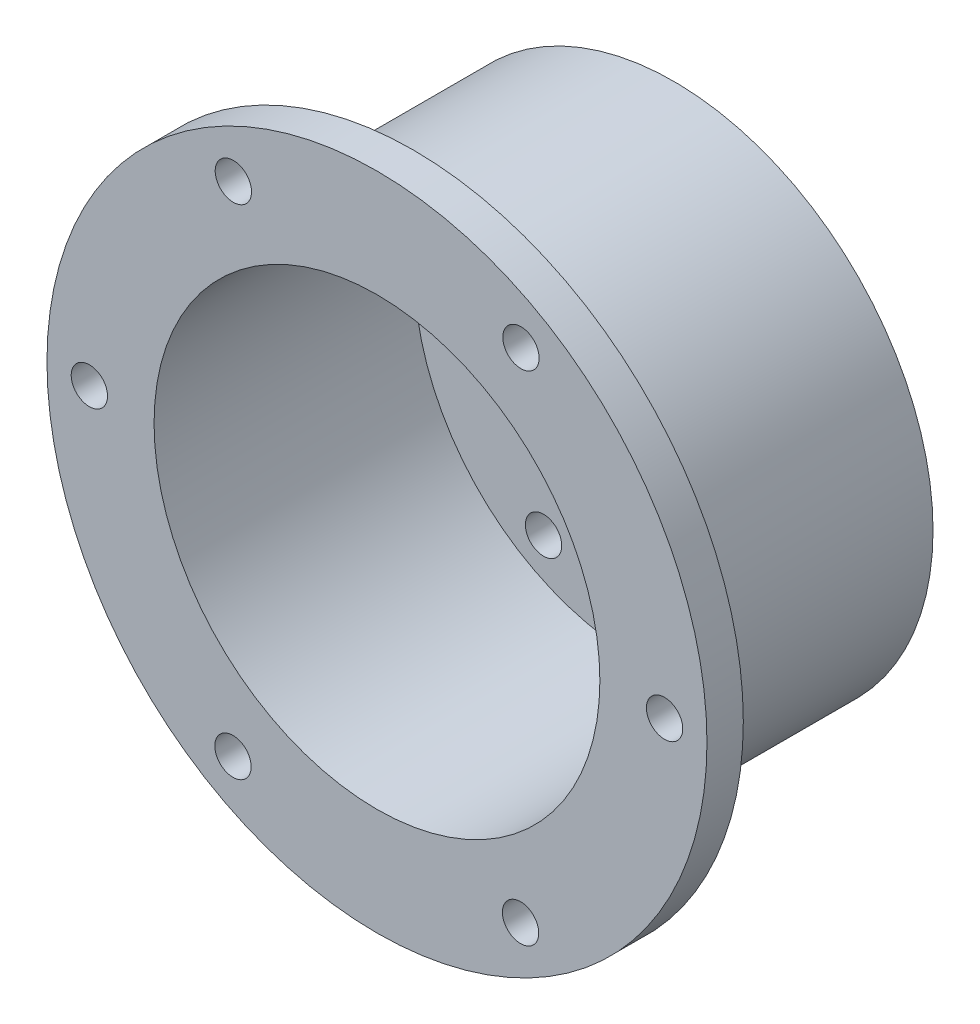
from build123d import *

# Parameters (mm, degrees)
CROQUIS1_R              = 21.4
CROQUIS1_R_2            = 18.4
SALIENTE_EXTRUIR1_DEPTH = 24.5
CROQUIS2_R              = 18.4
SALIENTE_EXTRUIR2_DEPTH = 3
SALIENTE_EXTRUIR3_START = -3
CROQUIS3_R              = 27.24
CROQUIS3_R_2            = 21.4
SALIENTE_EXTRUIR3_DEPTH = 3
CROQUIS4_R              = 6
CROQUIS4_R_2            = 1.5
CORTAR_EXTRUIR1_DEPTH   = 3
CROQUIS6_R              = 1.5
CORTAR_EXTRUIR2_DEPTH   = 3


with BuildPart() as part:
    # Croquis1 → Saliente-Extruir1 (new body)
    with BuildSketch(Plane.XY):
        Circle(CROQUIS1_R)
        Circle(CROQUIS1_R_2, mode=Mode.SUBTRACT)
    extrude(amount=SALIENTE_EXTRUIR1_DEPTH)

    # Croquis2 → Saliente-Extruir2 (add)
    with BuildSketch(Plane(origin=(0, 0, 0), x_dir=(-1, 0, 0), z_dir=(0, 0, -1))):
        Circle(CROQUIS2_R)
    extrude(amount=-SALIENTE_EXTRUIR2_DEPTH)

    # Croquis3 → Saliente-Extruir3 (add)
    with BuildSketch(Plane.XY.offset(24.5).offset(SALIENTE_EXTRUIR3_START)):
        Circle(CROQUIS3_R)
        Circle(CROQUIS3_R_2, mode=Mode.SUBTRACT)
    extrude(amount=SALIENTE_EXTRUIR3_DEPTH)

    # Croquis4 → Cortar-Extruir1 (cut)
    with BuildSketch(Plane(origin=(0, 0, 0), x_dir=(-1, 0, 0), z_dir=(0, 0, -1))):
        with Locations((0, -7)):
            Circle(CROQUIS4_R)
        with Locations((-15.5, 0)):
            Circle(CROQUIS4_R_2)
        with Locations((-7.75, 13.423393759)):
            Circle(CROQUIS4_R_2)
        with Locations((7.75, 13.423393759)):
            Circle(CROQUIS4_R_2)
        with Locations((15.5, 0)):
            Circle(CROQUIS4_R_2)
        with Locations((7.75, -13.423393759)):
            Circle(CROQUIS4_R_2)
        with Locations((-7.75, -13.423393759)):
            Circle(CROQUIS4_R_2)
    extrude(amount=-CORTAR_EXTRUIR1_DEPTH, mode=Mode.SUBTRACT)

    # Croquis6 → Cortar-Extruir2 (cut)
    with BuildSketch(Plane.XY.offset(24.5)):
        with Locations((-11.854123509, 20.568601212)):
            Circle(CROQUIS6_R)
        with Locations((11.885869416, 20.550272705)):
            Circle(CROQUIS6_R)
        with Locations((23.739992925, -0.018328508)):
            Circle(CROQUIS6_R)
        with Locations((11.854123509, -20.568601212)):
            Circle(CROQUIS6_R)
        with Locations((-11.885869416, -20.550272705)):
            Circle(CROQUIS6_R)
        with Locations((-23.739992925, 0.018328508)):
            Circle(CROQUIS6_R)
    extrude(amount=-CORTAR_EXTRUIR2_DEPTH, mode=Mode.SUBTRACT)


solid = part.part
